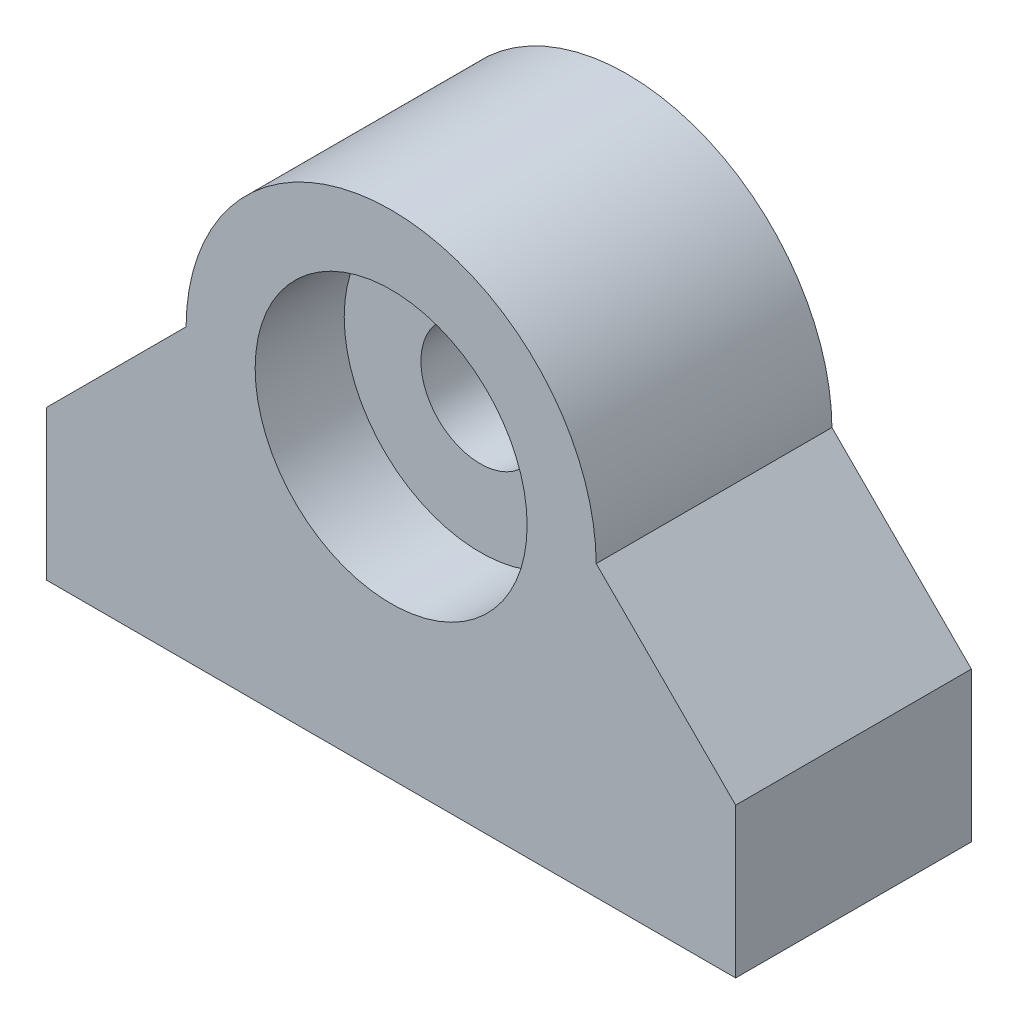
from build123d import *

# Parameters (mm, degrees)
SKETCH1_R                 = 7.5
BOSS_EXTRUDE1_DEPTH       = 13
BOSS_EXTRUDE2_DEPTH       = 1.5875
BOSS_EXTRUDE2_DEPTH_BACK  = 1.5875
SKETCH3_R                 = 8.7376
SKETCH3_R_2               = 3.27025
M4X0_7_TAPPED_HOLE1_D     = 3.3
M4X0_7_TAPPED_HOLE1_DEPTH = 10.1092
M4X0_7_TAPPED_HOLE1_TIP   = 0.991420021


with BuildPart() as part:
    # Sketch1 → Boss-Extrude1 (new body)
    with BuildSketch(Plane.XY):
        with BuildLine():
            Line((0, 0), (-19, 0))
            Line((-19, 0), (-19, 8.255))
            Line((-19, 8.255), (-11.309775732, 15.945224268))
            ThreePointArc((-11.309775732, 15.945224268), (0, 27.184), (11.309775732, 15.945224268))
            Line((11.309775732, 15.945224268), (19, 8.255))
            Line((19, 8.255), (19, 0))
            Line((19, 0), (0, 0))
        make_face()
        with Locations((0, 15.874)):
            Circle(SKETCH1_R, mode=Mode.SUBTRACT)
    extrude(amount=BOSS_EXTRUDE1_DEPTH)

    # Sketch3 → Boss-Extrude2 (add, two sides: drawn at the far end of the back side and taken through both)
    with BuildSketch(Plane.XY.offset(6.5).offset(-BOSS_EXTRUDE2_DEPTH_BACK)):
        with Locations((0, 15.874)):
            Circle(SKETCH3_R)
        with Locations((0, 15.874)):
            Circle(SKETCH3_R_2, mode=Mode.SUBTRACT)
    extrude(amount=BOSS_EXTRUDE2_DEPTH + BOSS_EXTRUDE2_DEPTH_BACK)

    # M4x0.7 Tapped Hole1
    with Locations(Plane(origin=(0, 0, 0), x_dir=(-1, 0, 0), z_dir=(0, -1, 0))):
        with Locations((10, -6.5), (-10, -6.5)):
            Hole(M4X0_7_TAPPED_HOLE1_D / 2, depth=M4X0_7_TAPPED_HOLE1_DEPTH)
            with Locations((0, 0, -(M4X0_7_TAPPED_HOLE1_DEPTH + M4X0_7_TAPPED_HOLE1_TIP / 2))):  # 118° drill point
                Cone(0, M4X0_7_TAPPED_HOLE1_D / 2, M4X0_7_TAPPED_HOLE1_TIP, mode=Mode.SUBTRACT)


solid = part.part
